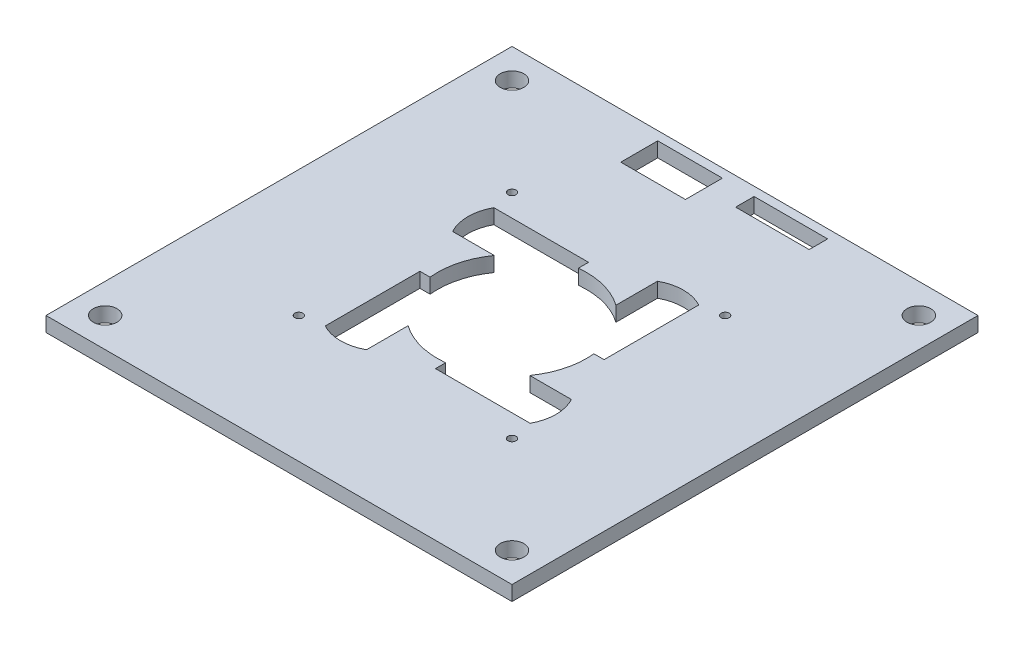
from build123d import *

# Parameters (mm, degrees)
SKETCH1_W           = 200.025
SKETCH1_H           = 200.025
SKETCH1_R           = 5.08
SKETCH1_R_2         = 1.7272
SKETCH1_W_2         = 27.758924323
SKETCH1_H_2         = 15.874128766
SKETCH1_W_3         = 31.563171913
SKETCH1_H_3         = 7.937064383
BOSS_EXTRUDE1_DEPTH = 6.35
BOSS_EXTRUDE2_START = -6.350254
SKETCH2_W           = 200.025
SKETCH2_H           = 200.025
SKETCH2_R           = 5.08
SKETCH2_W_2         = 149.225
SKETCH2_H_2         = 149.225
SKETCH2_W_3         = 27.758924323
SKETCH2_H_3         = 15.874128766
SKETCH2_W_4         = 31.563171913
SKETCH2_H_4         = 7.937064383
BOSS_EXTRUDE2_DEPTH = 6.350254


with BuildPart() as part:
    # Sketch1 → Boss-Extrude1 (new body)
    with BuildSketch(Plane(origin=(0, 0, 0), x_dir=(1, 0, 0), z_dir=(0, 1, 0))):
        Rectangle(SKETCH1_W, SKETCH1_H)
        with Locations((-87.3125, 87.3125)):
            Circle(SKETCH1_R, mode=Mode.SUBTRACT)
        with Locations((87.3125, 87.3125)):
            Circle(SKETCH1_R, mode=Mode.SUBTRACT)
        with Locations((-87.3125, -87.3125)):
            Circle(SKETCH1_R, mode=Mode.SUBTRACT)
        with Locations((87.3125, -87.3125)):
            Circle(SKETCH1_R, mode=Mode.SUBTRACT)
        with Locations((45.75, -45.75)):
            Circle(SKETCH1_R_2, mode=Mode.SUBTRACT)
        with Locations((-45.75, -45.75)):
            Circle(SKETCH1_R_2, mode=Mode.SUBTRACT)
        with Locations((45.75, 45.75)):
            Circle(SKETCH1_R_2, mode=Mode.SUBTRACT)
        with Locations((-45.75, 45.75)):
            Circle(SKETCH1_R_2, mode=Mode.SUBTRACT)
        with Locations((-19.766444167, 88.265435617)):
            Rectangle(SKETCH1_W_2, SKETCH1_H_2, mode=Mode.SUBTRACT)
        with Locations((23.505506165, 92.233967809)):
            Rectangle(SKETCH1_W_3, SKETCH1_H_3, mode=Mode.SUBTRACT)
        with BuildLine():
            Line((43.972, -36.1866), (3.332, -36.1866))
            Line((3.332, -36.1866), (3.332, -31.826118331))
            ThreePointArc((3.332, -31.826118331), (-8.096646292, -30.958817013), (-18.4866, -26.11990912))
            Line((-18.4866, -26.11990912), (-18.4866, -43.972))
            ThreePointArc((-18.4866, -43.972), (-27.3366, -46.226154377), (-36.1866, -43.972))
            Line((-36.1866, -43.972), (-36.1866, -3.332))
            Line((-36.1866, -3.332), (-31.826118331, -3.332))
            ThreePointArc((-31.826118331, -3.332), (-30.958817013, 8.096646292), (-26.11990912, 18.4866))
            Line((-26.11990912, 18.4866), (-43.972, 18.4866))
            ThreePointArc((-43.972, 18.4866), (-46.226154377, 27.3366), (-43.972, 36.1866))
            Line((-43.972, 36.1866), (-3.332, 36.1866))
            Line((-3.332, 36.1866), (-3.332, 31.826118331))
            ThreePointArc((-3.332, 31.826118331), (8.096646292, 30.958817013), (18.4866, 26.11990912))
            Line((18.4866, 26.11990912), (18.4866, 43.972))
            ThreePointArc((18.4866, 43.972), (27.3366, 46.226154377), (36.1866, 43.972))
            Line((36.1866, 43.972), (36.1866, 3.332))
            Line((36.1866, 3.332), (31.826118331, 3.332))
            ThreePointArc((31.826118331, 3.332), (30.958817013, -8.096646292), (26.11990912, -18.4866))
            Line((26.11990912, -18.4866), (43.972, -18.4866))
            ThreePointArc((43.972, -18.4866), (46.226154377, -27.3366), (43.972, -36.1866))
        make_face(mode=Mode.SUBTRACT)
    extrude(amount=BOSS_EXTRUDE1_DEPTH)

    # Sketch2 → Boss-Extrude2 (add)
    with BuildSketch(Plane(origin=(0, 6.35, 0), x_dir=(1, 0, 0), z_dir=(0, 1, 0)).offset(BOSS_EXTRUDE2_START)):
        Rectangle(SKETCH2_W, SKETCH2_H)
        with Locations((-87.3125, 87.3125)):
            Circle(SKETCH2_R, mode=Mode.SUBTRACT)
        with Locations((87.3125, 87.3125)):
            Circle(SKETCH2_R, mode=Mode.SUBTRACT)
        with Locations((-87.3125, -87.3125)):
            Circle(SKETCH2_R, mode=Mode.SUBTRACT)
        with Locations((87.3125, -87.3125)):
            Circle(SKETCH2_R, mode=Mode.SUBTRACT)
        Rectangle(SKETCH2_W_2, SKETCH2_H_2, mode=Mode.SUBTRACT)
        with Locations((-19.766444167, 88.265435617)):
            Rectangle(SKETCH2_W_3, SKETCH2_H_3, mode=Mode.SUBTRACT)
        with Locations((23.505506165, 92.233967809)):
            Rectangle(SKETCH2_W_4, SKETCH2_H_4, mode=Mode.SUBTRACT)
    extrude(amount=BOSS_EXTRUDE2_DEPTH)


solid = part.part
